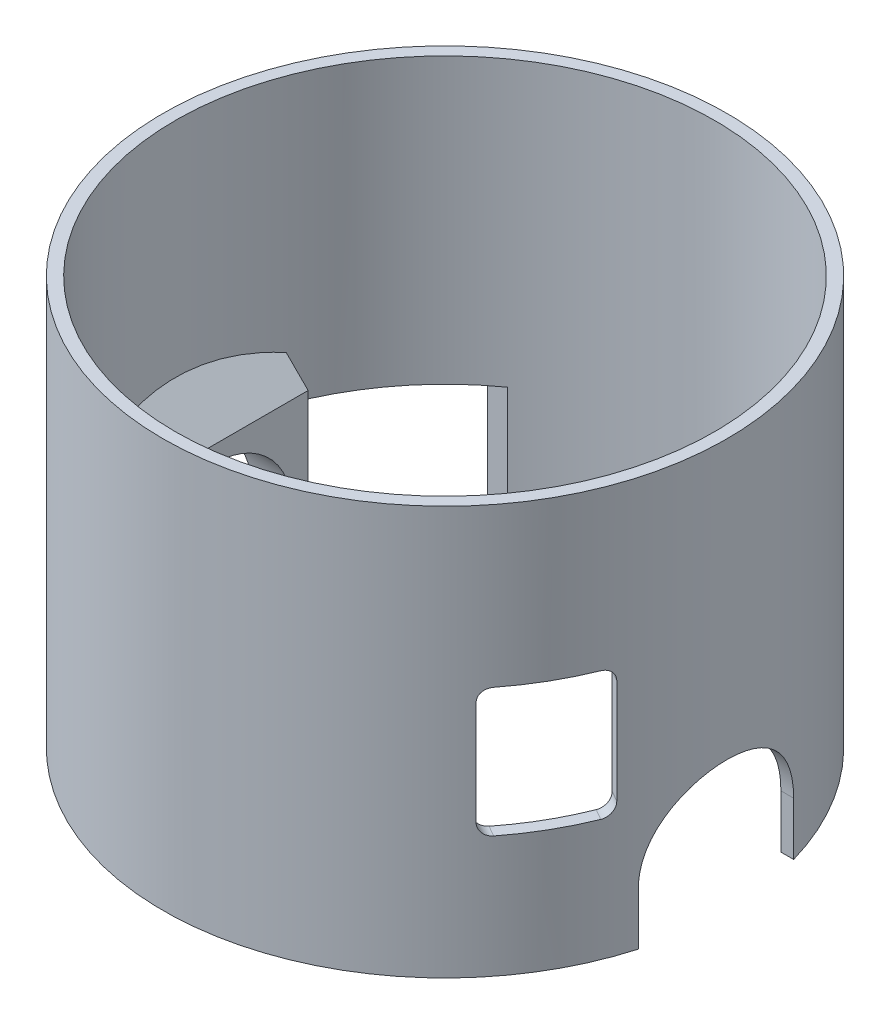
from build123d import *

# Parameters (mm, degrees)
SKETCH1_R               = 69
SKETCH1_R_2             = 66
BOSS_EXTRUDE1_DEPTH     = 100
CUT_EXTRUDE1_REACH      = 200.205
SKETCH3_W               = 20
SKETCH3_H               = 28
FILLET1_R               = 3
SKETCH4_W               = 30.4
SKETCH4_H               = 30.4
CUT_EXTRUDE2_DEPTH      = 140.721151039
CUT_EXTRUDE6_DEPTH      = 140.721151039
CUT_EXTRUDE6_DEPTH_BACK = 140.721151039
BOSS_EXTRUDE2_REACH     = 198.221
BOSS_EXTRUDE2_START     = -56.5
SKETCH8_W               = 46
SKETCH8_H               = 35
BOSS_EXTRUDE4_DEPTH     = 30
SKETCH9_OUTSIDE_W       = 207.751
SKETCH9_OUTSIDE_H       = 186.632
SKETCH9_OUTSIDE_R       = 69
CUT_EXTRUDE7_DEPTH      = 152.269287203
CUT_EXTRUDE8_DEPTH      = 140.721151039
CUT_EXTRUDE9_DEPTH      = 140.721151039
CUT_EXTRUDE10_REACH     = 200.205
SKETCH10_W              = 25.2
SKETCH10_H              = 31.5
FILLET2_R               = 3


with BuildPart() as part:
    # Sketch1 → Boss-Extrude1 (new body)
    with BuildSketch(Plane(origin=(0, 0, 0), x_dir=(1, 0, 0), z_dir=(0, 1, 0))):
        Circle(SKETCH1_R)
        Circle(SKETCH1_R_2, mode=Mode.SUBTRACT)
    extrude(amount=BOSS_EXTRUDE1_DEPTH)

    # Sketch3 → Cut-Extrude1 (cut, up to next)
    with BuildSketch(Plane(origin=(-64.951905284, 0, 37.5), x_dir=(-0.5000000000000016, 0, -0.8660254037844378), z_dir=(0.8660254037844377, 0, -0.5000000000000014)), mode=Mode.PRIVATE) as cut_extrude1_sk1:
        with Locations((0, 45.5)):
            Rectangle(SKETCH3_W, SKETCH3_H)
    cut_extrude1_tool1 = extrude(cut_extrude1_sk1.sketch, amount=CUT_EXTRUDE1_REACH, mode=Mode.PRIVATE) & part.part
    add(cut_extrude1_tool1.solids().sort_by_distance((-64.951905, 45.5, 37.5))[0], mode=Mode.SUBTRACT)

    # Fillet1
    fillet1_edges = [part.edges().sort_by_distance(p)[0] for p in [
        (-52.811327716, 31.5, 42.037639657),
        (-62.811327716, 31.5, 24.717131581),
        (-52.811327716, 59.5, 42.037639657),
        (-62.811327716, 59.5, 24.717131581),
    ]]
    fillet(fillet1_edges, radius=FILLET1_R)

    # Sketch4 → Cut-Extrude2 (cut, through all)
    with BuildSketch(Plane(origin=(0, 0, 0), x_dir=(0, 0, -1), z_dir=(1, 0, 0))):
        with Locations((38.5, 15.2)):
            Rectangle(SKETCH4_W, SKETCH4_H)
    extrude(amount=-CUT_EXTRUDE2_DEPTH, mode=Mode.SUBTRACT)

    # Sketch5 → Cut-Extrude6 (cut, two sides: drawn at the far end of the back side and taken through both)
    with BuildSketch(Plane(origin=(0, 0, 0), x_dir=(0, 0, -1), z_dir=(1, 0, 0)).offset(-CUT_EXTRUDE6_DEPTH_BACK)):
        with BuildLine():
            Line((19, 13), (19, -6))
            Line((19, -6), (-19, -6))
            Line((-19, -6), (-19, 13))
            ThreePointArc((-19, 13), (0, 32), (19, 13))
        make_face()
    extrude(amount=CUT_EXTRUDE6_DEPTH + CUT_EXTRUDE6_DEPTH_BACK, mode=Mode.SUBTRACT)

    # Sketch6 → Boss-Extrude2 (add, up to next)
    with BuildSketch(Plane(origin=(0, 0, 0), x_dir=(0, 0, -1), z_dir=(1, 0, 0)).offset(BOSS_EXTRUDE2_START), mode=Mode.PRIVATE) as boss_extrude2_sk1:
        with BuildLine():
            Line((19, 13), (19, 0))
            Line((19, 0), (23, 0))
            Line((23, 0), (23, 13))
            ThreePointArc((23, 13), (0, 36), (-23, 13))
            Line((-23, 13), (-23, 0))
            Line((-23, 0), (-19, 0))
            Line((-19, 0), (-19, 13))
            ThreePointArc((-19, 13), (0, 32), (19, 13))
        make_face()
    boss_extrude2_tool1 = extrude(boss_extrude2_sk1.sketch, amount=-BOSS_EXTRUDE2_REACH, mode=Mode.PRIVATE) - part.part
    add(boss_extrude2_tool1.solids().sort_by_distance((-56.5, 6.5, 22.415877))[0])

    # Sketch8 → Boss-Extrude4 (add)
    with BuildSketch(Plane(origin=(-10.25, -10.25, 0), x_dir=(0, 0, -1), z_dir=(-0.7071067811865512, -0.7071067811865438, 0))):
        with Locations((0, -65.451533137)):
            Rectangle(SKETCH8_W, SKETCH8_H)
    extrude(amount=BOSS_EXTRUDE4_DEPTH)

    # Sketch9 outside → Cut-Extrude7 (cut, through all)
    with BuildSketch(Plane.XZ):
        with Locations((-10.5595, 0)):
            Rectangle(SKETCH9_OUTSIDE_W, SKETCH9_OUTSIDE_H)
        Circle(SKETCH9_OUTSIDE_R, mode=Mode.SUBTRACT)
    extrude(amount=-CUT_EXTRUDE7_DEPTH, mode=Mode.SUBTRACT)

    # Sketch9<3> → Cut-Extrude8 (cut, through all)
    with BuildSketch(Plane.XZ):
        with BuildLine():
            ThreePointArc((-61.750384614, -23.3), (21.162519062, -62.515180452), (63.206012372, 19))
            ThreePointArc((63.206012372, 19), (2.109760074, 65.966271021), (-61.862751313, 23))
            Line((-61.862751313, 23), (-56.5, 23))
            Line((-56.5, 23), (-56.5, 19))
            Line((-56.5, 19), (-56.5, -19))
            Line((-56.5, -19), (-56.5, -23))
            Line((-56.5, -23), (-61.862751313, -23))
            ThreePointArc((-61.862751313, -23), (-61.806749983, -23.150068176), (-61.750384614, -23.3))
        make_face()
    extrude(amount=-CUT_EXTRUDE8_DEPTH, mode=Mode.SUBTRACT)

    # Sketch5<2> → Cut-Extrude9 (cut, through all)
    with BuildSketch(Plane(origin=(0, 0, 0), x_dir=(0, 0, -1), z_dir=(1, 0, 0))):
        with BuildLine():
            Line((19, 13), (19, -6))
            Line((19, -6), (-19, -6))
            Line((-19, -6), (-19, 13))
            ThreePointArc((-19, 13), (0, 32), (19, 13))
        make_face()
    extrude(amount=-CUT_EXTRUDE9_DEPTH, mode=Mode.SUBTRACT)

    # Sketch10 → Cut-Extrude10 (cut, up to next)
    with BuildSketch(Plane(origin=(64.951905284, 0, 37.5), x_dir=(0.5000000000000006, 0, -0.8660254037844384), z_dir=(0.8660254037844384, 0, 0.5000000000000006)), mode=Mode.PRIVATE) as cut_extrude10_sk1:
        with Locations((0, 45.5)):
            Rectangle(SKETCH10_W, SKETCH10_H)
    cut_extrude10_tool1 = extrude(cut_extrude10_sk1.sketch, amount=-CUT_EXTRUDE10_REACH, mode=Mode.PRIVATE) & part.part
    add(cut_extrude10_tool1.solids().sort_by_distance((64.951905, 45.5, 37.5))[0], mode=Mode.SUBTRACT)

    # Fillet2
    fillet2_edges = [part.edges().sort_by_distance(p)[0] for p in [
        (51.128708368, 29.75, 44.068400323),
        (51.128708368, 61.25, 44.068400323),
        (63.728708368, 61.25, 22.244560148),
        (63.728708368, 29.75, 22.244560148),
    ]]
    fillet(fillet2_edges, radius=FILLET2_R)


solid = part.part
